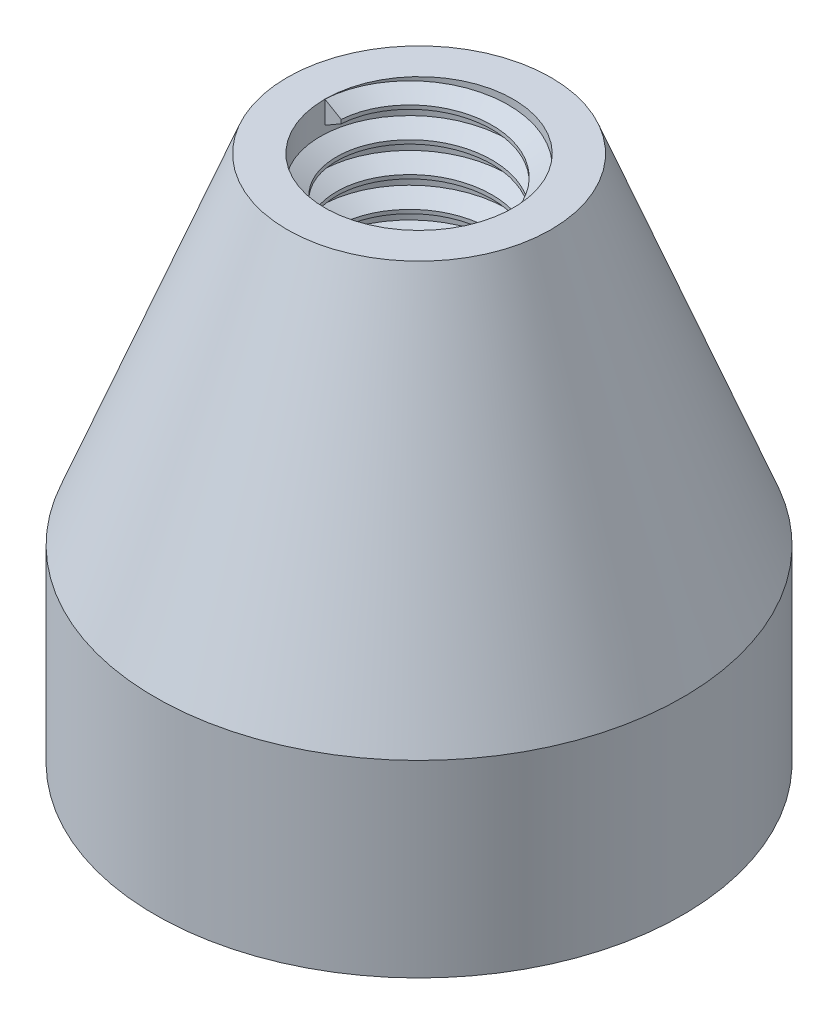
from build123d import *

# Parameters (mm, degrees)
THREAD1_PITCH = 0.8


with BuildPart() as part:
    # Sketch1 → Revolve1 (revolve)
    with BuildSketch(Plane(origin=(0, 0, 0), x_dir=(0, 0, -1), z_dir=(1, 0, 0))):
        Polygon((1778.036254975, 1559.979920793), (1775.536254975, 1565.487394057), (1775.536254975, 1568.979920793), (1776.536254975, 1568.979920793), (1780.036254975, 1559.979920793), (1780.036254975, 1554.979920793), (1778.036254975, 1554.979920793), align=None)
    revolve(axis=Axis((0, 1554.979920793, -1773.036254975), (0, 1, 0)))

    # Thread1: the profile of Thread Profile1 profile screwed along a right-hand helix of 4.375 turns, 8 arcs to a turn; built about Z, then put on its axis
    thread1_z = Axis((0, 0, 0), (0, 0, 1))
    thread1_corners = [(2.5003, 0, 0.600173208), (2.066987296, 0, 0.350000001), (2.066987296, 0, 0.250000001), (2.5003, 0, -0.000173205)]
    with BuildLine(mode=Mode.PRIVATE) as thread1_profile:
        Line(thread1_corners[0], thread1_corners[1])
        Line(thread1_corners[1], thread1_corners[2])
        Line(thread1_corners[2], thread1_corners[3])
        Line(thread1_corners[3], thread1_corners[0])
    thread1_cap = Face(thread1_profile.wire())
    thread1_turn_angles = [0, 22.5, 45, 67.5, 90, 112.5, 135, 157.5, 180, 202.5, 225, 247.5, 270, 292.5, 315, 337.5, 360]
    thread1_turn_weights = [1, 0.9238795325112867, 1, 0.9238795325112867, 1, 0.9238795325112867, 1, 0.9238795325112867, 1, 0.9238795325112867, 1, 0.9238795325112867, 1, 0.9238795325112867, 1, 0.9238795325112867, 1]
    thread1_turn_rails = [Edge.make_bspline([Vector(p[0], p[1], 0).rotate(thread1_z, thread1_turn_angles[k]) / thread1_turn_weights[k] + Vector(0, 0, p[2] + THREAD1_PITCH * thread1_turn_angles[k] / 360) for k in range(17)], [0, 0, 0, 1, 1, 2, 2, 3, 3, 4, 4, 5, 5, 6, 6, 7, 7, 8, 8, 8], 2, thread1_turn_weights) for p in thread1_corners]
    thread1_turn_sides = [Face.make_surface_from_curves(thread1_turn_rails[p[0]], thread1_turn_rails[p[1]]) for p in [(0, 1), (1, 2), (2, 3), (3, 0)]]
    thread1_last_angles = [1440, 1462.5, 1485, 1507.5, 1530, 1552.5, 1575]
    thread1_last_weights = [1, 0.9238795325112867, 1, 0.9238795325112867, 1, 0.9238795325112867, 1]
    thread1_last_rails = [Edge.make_bspline([Vector(p[0], p[1], 0).rotate(thread1_z, thread1_last_angles[k]) / thread1_last_weights[k] + Vector(0, 0, p[2] + THREAD1_PITCH * thread1_last_angles[k] / 360) for k in range(7)], [0, 0, 0, 1, 1, 2, 2, 3, 3, 3], 2, thread1_last_weights) for p in thread1_corners]
    thread1_last_sides = [Face.make_surface_from_curves(thread1_last_rails[p[0]], thread1_last_rails[p[1]]) for p in [(0, 1), (1, 2), (2, 3), (3, 0)]]
    thread1 = Plane(origin=(0, 1568.979920793, -1773.036254975), x_dir=(-1, 0, 0), z_dir=(0, -1, 0)) * Solid(Shell([*[p.moved(Location((0, 0, THREAD1_PITCH * i))) for i in range(4) for p in thread1_turn_sides], *thread1_last_sides, thread1_cap, thread1_cap.rotate(thread1_z, 1575).moved(Location((0, 0, THREAD1_PITCH * 1575 / 360)))]))
    add(thread1)


solid = part.part
